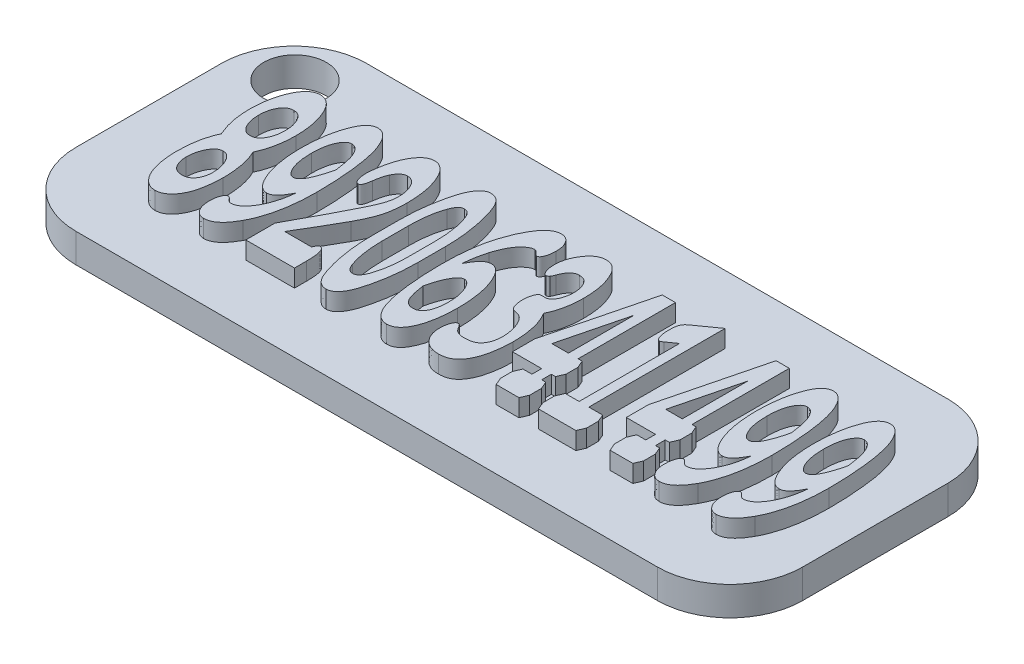
from build123d import *

# Parameters (mm, degrees)
SKETCH_1_W          = 50
SKETCH_1_H          = 20
EXTRUDE_1_DEPTH     = 2
EXTRUDE_446_DEPTH   = 1.2
FILLET_1_R          = 5
FILLET_2_R          = 5
FILLET_3_R          = 5
FILLET_4_R          = 5
SKETCH_4_R          = 2.151855383
CUT_EXTRUDE_1_DEPTH = 3


with BuildPart() as part:
    # Эскиз1 → Бобышка-Вытянуть1 (new body)
    with BuildSketch(Plane(origin=(0, 0, 0), x_dir=(1, 0, 0), z_dir=(0, 1, 0))):
        with Locations((25, 10)):
            Rectangle(SKETCH_1_W, SKETCH_1_H)
    extrude(amount=EXTRUDE_1_DEPTH)

    # Эскиз2 → Extrude 446 (add)
    # profile 1 of 11: a face of its own
    with BuildSketch(Plane(origin=(0, 2, 0), x_dir=(1, 0, 0), z_dir=(0, 1, 0))):
        with BuildLine():
            add(Edge.make_bspline(
                [(7.573556309, 9.600285908), (7.614097975, 9.514557394), (7.696746897, 9.339789807), (7.797801731, 9.062374027), (7.880558655, 8.767248004), (7.951489199, 8.456701902), (8.00595283, 8.129212501), (8.044897616, 7.785319285), (8.06867813, 7.42575086), (8.071567234, 7.180504155), (8.073036116, 7.05581548)],
                knots=[0, 0, 0, 0, 0.869863627, 1.773318598, 2.705048754, 3.681115649, 4.69499462, 5.749702211, 6.855900433, 8, 8, 8, 8], degree=3))
            add(Edge.make_bspline(
                [(8.073036116, 7.05581548), (8.071300059, 6.917145605), (8.067898843, 6.645468945), (8.03317454, 6.246264419), (7.975620786, 5.864714253), (7.898566629, 5.502509161), (7.800399961, 5.166235556), (7.670137386, 4.865473177), (7.520838011, 4.597477557), (7.339918246, 4.372882613), (7.143065075, 4.191376949), (6.932401715, 4.057830032), (6.707417427, 3.977887628), (6.552534727, 3.967409177), (6.47522375, 3.962178772)],
                knots=[0, 0, 0, 0, 1.307194334, 2.561004629, 3.774488178, 4.943198719, 6.050810285, 7.0706307, 8.027859035, 8.934048178, 9.777701725, 10.541735887, 11.272095442, 12, 12, 12, 12], degree=3))
            add(Edge.make_bspline(
                [(6.47522375, 3.962178772), (6.398758529, 3.967377244), (6.245524582, 3.977794821), (6.022692765, 4.058574413), (5.812990911, 4.190715372), (5.618085633, 4.372268194), (5.44331203, 4.599271211), (5.292379621, 4.86580684), (5.163838969, 5.168326766), (5.064629644, 5.505868942), (4.987398844, 5.868910316), (4.934027364, 6.250889169), (4.897970237, 6.648043089), (4.894747173, 6.91800445), (4.89310185, 7.05581548)],
                knots=[0, 0, 0, 0, 0.721796221, 1.446457375, 2.212675403, 3.05265627, 3.951211607, 4.911176021, 5.941488938, 7.052266429, 8.232375546, 9.44812684, 10.697308883, 12, 12, 12, 12], degree=3))
            add(Edge.make_bspline(
                [(4.89310185, 7.05581548), (4.894568323, 7.180504891), (4.897452689, 7.425753043), (4.9212673, 7.78531105), (4.960090766, 8.129241336), (5.014981174, 8.456600333), (5.08446419, 8.767842206), (5.172490412, 9.061301884), (5.268561762, 9.340392082), (5.351724858, 9.514667147), (5.392581656, 9.600285908)],
                knots=[0, 0, 0, 0, 1.144171302, 2.250438881, 3.305212602, 4.319155143, 5.295283236, 6.229301096, 7.130081833, 8, 8, 8, 8], degree=3))
            add(Edge.make_bspline(
                [(5.392581656, 9.600285908), (5.315817568, 9.787048365), (5.160841455, 10.164096025), (5.006931525, 10.766990108), (4.909981225, 11.402377485), (4.898807421, 11.838421115), (4.89310185, 12.061073855)],
                knots=[0, 0, 0, 0, 0.957073933, 1.932200357, 2.944139471, 4, 4, 4, 4], degree=3))
            add(Edge.make_bspline(
                [(4.89310185, 12.061073855), (4.898418341, 12.27754542), (4.908708054, 12.696511582), (4.993522254, 13.301262805), (5.130459125, 13.859724169), (5.292766455, 14.287625184), (5.444959878, 14.59626455), (5.572022432, 14.792435075), (5.701256202, 14.962512673), (5.841669645, 15.100122201), (5.988929324, 15.210766986), (6.147233304, 15.286698295), (6.313045616, 15.333643061), (6.426107165, 15.339862642), (6.483068983, 15.342996144)],
                knots=[0, 0, 0, 0, 1.967284804, 3.807547495, 5.539313067, 7.184775065, 7.957393082, 8.663057112, 9.306676465, 9.895090154, 10.445108397, 10.973224193, 11.482697546, 12, 12, 12, 12], degree=3))
            add(Edge.make_bspline(
                [(6.483068983, 15.342996144), (6.540030622, 15.339862528), (6.653091816, 15.33364272), (6.818906789, 15.286699655), (6.977200186, 15.210761579), (7.124502289, 15.100143922), (7.264739854, 14.962421929), (7.394438864, 14.793194832), (7.518098227, 14.595404626), (7.670991349, 14.28749902), (7.836385865, 13.860286235), (7.972388537, 13.301187823), (8.057492836, 12.696532351), (8.06774106, 12.277552495), (8.073036116, 12.061073855)],
                knots=[0, 0, 0, 0, 0.517362775, 1.026895537, 1.555072916, 2.105155296, 2.693637599, 3.337332004, 4.038837688, 4.811545799, 6.460041003, 8.192008513, 10.032485794, 12, 12, 12, 12], degree=3))
            add(Edge.make_bspline(
                [(8.073036116, 12.061073855), (8.067469393, 11.836644637), (8.056587536, 11.397929314), (7.95824123, 10.760579226), (7.810565083, 10.157347516), (7.651813566, 9.784220506), (7.573556309, 9.600285908)],
                knots=[0, 0, 0, 0, 1.063791813, 2.079505389, 3.053283751, 4, 4, 4, 4], degree=3))
        make_face()
        with BuildLine():
            add(Edge.make_bspline(
                [(7.40357627, 12.000927072), (7.400881187, 12.101399241), (7.3956698, 12.295678693), (7.346723591, 12.574577781), (7.273005759, 12.832078474), (7.163415472, 13.060108044), (7.032907644, 13.254347429), (6.872502773, 13.398604446), (6.686741605, 13.488581823), (6.552877353, 13.497503384), (6.48568406, 13.50198157)],
                knots=[0, 0, 0, 0, 1.239528042, 2.396831194, 3.486589409, 4.536162785, 5.509682768, 6.35620442, 7.174895202, 8, 8, 8, 8], degree=3))
            add(Edge.make_bspline(
                [(6.48568406, 13.50198157), (6.41756145, 13.497655353), (6.282708964, 13.489091368), (6.096066845, 13.397823779), (5.933161756, 13.255405207), (5.802856554, 13.059951899), (5.693093666, 12.832123363), (5.619425513, 12.574564807), (5.570465074, 12.295682293), (5.565255725, 12.101400468), (5.562561695, 12.000927072)],
                knots=[0, 0, 0, 0, 0.833820688, 1.650594315, 2.50321944, 3.474459699, 4.521575254, 5.608781546, 6.763374602, 8, 8, 8, 8], degree=3))
            add(Edge.make_bspline(
                [(5.562561695, 12.000927072), (5.565266502, 11.89959127), (5.570497938, 11.703595072), (5.619342719, 11.422020541), (5.693413454, 11.162223891), (5.80108844, 10.931934152), (5.93514389, 10.738900345), (6.094340772, 10.592500066), (6.283734232, 10.506365477), (6.417745012, 10.495115588), (6.48568406, 10.489412265)],
                knots=[0, 0, 0, 0, 1.241668429, 2.401543046, 3.494043673, 4.546047416, 5.504137523, 6.359918461, 7.168532727, 8, 8, 8, 8], degree=3))
            add(Edge.make_bspline(
                [(6.48568406, 10.489412265), (6.552695802, 10.495261034), (6.685717473, 10.506871134), (6.874233464, 10.591733044), (7.030924822, 10.739942893), (7.165187614, 10.931776637), (7.272684512, 11.162269517), (7.346806805, 11.422007357), (7.395636821, 11.703598728), (7.400870371, 11.899592516), (7.40357627, 12.000927072)],
                knots=[0, 0, 0, 0, 0.822795555, 1.633290479, 2.483061068, 3.443379481, 4.497829953, 5.592871494, 6.755443724, 8, 8, 8, 8], degree=3))
        make_face(mode=Mode.SUBTRACT)
        with BuildLine():
            add(Edge.make_bspline(
                [(7.40357627, 7.032279782), (7.40083224, 7.132728778), (7.395428238, 7.330549733), (7.344625757, 7.619766765), (7.260193419, 7.893490889), (7.148083999, 8.145792408), (7.013914707, 8.362633192), (6.856156217, 8.525506054), (6.676981716, 8.630098946), (6.547067499, 8.642358414), (6.483068983, 8.64839769)],
                knots=[0, 0, 0, 0, 1.189489759, 2.34254209, 3.466495789, 4.576118851, 5.607605723, 6.469471387, 7.246028937, 8, 8, 8, 8], degree=3))
            add(Edge.make_bspline(
                [(6.483068983, 8.64839769), (6.419071355, 8.642357997), (6.289158942, 8.630097682), (6.109970089, 8.525511526), (5.952276444, 8.362608226), (5.817382195, 8.145228937), (5.706032156, 7.890764764), (5.62148475, 7.614512598), (5.570417776, 7.320959943), (5.565221953, 7.119656519), (5.562561695, 7.016589317)],
                knots=[0, 0, 0, 0, 0.748318014, 1.519053169, 2.374456823, 3.398209916, 4.508873786, 5.634203001, 6.788713712, 8, 8, 8, 8], degree=3))
            add(Edge.make_bspline(
                [(5.562561695, 7.016589317), (5.564519013, 6.937906225), (5.568358614, 6.783556341), (5.614649943, 6.561063276), (5.686188734, 6.353459053), (5.781401031, 6.163023537), (5.912177847, 6.003496362), (6.075347034, 5.885390745), (6.270349502, 5.815595323), (6.410142975, 5.807445081), (6.483068983, 5.803193347)],
                knots=[0, 0, 0, 0, 1.103259055, 2.164224919, 3.174489227, 4.181783474, 5.137723691, 6.0412155, 6.978161634, 8, 8, 8, 8], degree=3))
            add(Edge.make_bspline(
                [(6.483068983, 5.803193347), (6.556895147, 5.807344341), (6.697617482, 5.81525668), (6.893245968, 5.885521907), (7.056713141, 6.002687874), (7.184294754, 6.164041181), (7.28132663, 6.35464223), (7.350843043, 6.565721818), (7.39824932, 6.79308981), (7.401765162, 6.950957658), (7.40357627, 7.032279782)],
                knots=[0, 0, 0, 0, 1.024249911, 1.952354446, 2.84732035, 3.786524278, 4.784313077, 5.807988776, 6.870833993, 8, 8, 8, 8], degree=3))
        make_face(mode=Mode.SUBTRACT)
    # profile 2 of 11: a face of its own
    with BuildSketch(Plane(origin=(0, 2, 0), x_dir=(1, 0, 0), z_dir=(0, 1, 0))):
        with BuildLine():
            add(Edge.make_bspline(
                [(11.487281327, 8.64839769), (11.443120138, 8.563194295), (11.360211839, 8.403233281), (11.227347166, 8.189670085), (11.101271099, 8.014308364), (10.981695952, 7.875258561), (10.860868515, 7.771543805), (10.73789485, 7.699387944), (10.611308828, 7.650740653), (10.523600736, 7.646361206), (10.480476482, 7.644207922)],
                knots=[0, 0, 0, 0, 1.544491333, 2.899630935, 4.044871523, 5.019150062, 5.845686048, 6.594201469, 7.308797954, 8, 8, 8, 8], degree=3))
            add(Edge.make_bspline(
                [(10.480476482, 7.644207922), (10.430290606, 7.647817631), (10.329782088, 7.655046887), (10.183984439, 7.712466058), (10.043153577, 7.800943198), (9.907418997, 7.92533019), (9.779803639, 8.086066605), (9.65342786, 8.277990517), (9.534963838, 8.506651707), (9.42092589, 8.765889021), (9.31824374, 9.051066319), (9.226522564, 9.355676466), (9.147531027, 9.677551496), (9.086438701, 10.01754375), (9.035758997, 10.373307064), (9.003124173, 10.746078019), (8.981616037, 11.135084147), (8.978430245, 11.400300708), (8.976806907, 11.535443274)],
                knots=[0, 0, 0, 0, 0.540116355, 1.081704643, 1.668900416, 2.328128021, 3.056702268, 3.878395356, 4.803970782, 5.831493441, 6.932328587, 8.071895476, 9.262630745, 10.505951035, 11.797462611, 13.138567462, 14.541941224, 16, 16, 16, 16], degree=3))
            add(Edge.make_bspline(
                [(8.976806907, 11.535443274), (8.979878585, 11.746549179), (8.985894355, 12.159992454), (9.045914146, 12.764320197), (9.136496445, 13.340136315), (9.231105871, 13.708310595), (9.277540822, 13.889013043)],
                knots=[0, 0, 0, 0, 1.064168464, 2.084135415, 3.059680597, 4, 4, 4, 4], degree=3))
            add(Edge.make_bspline(
                [(9.277540822, 13.889013043), (9.312722205, 14.002800007), (9.379225867, 14.217892454), (9.495353429, 14.516034372), (9.625556706, 14.767410328), (9.763771865, 14.976387376), (9.915484797, 15.139702578), (10.080541985, 15.254844306), (10.256576245, 15.329464525), (10.3795264, 15.338473449), (10.441250319, 15.342996144)],
                knots=[0, 0, 0, 0, 1.436180298, 2.714823602, 3.852703128, 4.844061658, 5.728925662, 6.522115595, 7.258066685, 8, 8, 8, 8], degree=3))
            add(Edge.make_bspline(
                [(10.441250319, 15.342996144), (10.48499613, 15.339980522), (10.572875844, 15.333922523), (10.703346169, 15.300039727), (10.826729708, 15.236568608), (10.949335325, 15.155760012), (11.063874085, 15.046298247), (11.173728678, 14.913745616), (11.28098276, 14.759182636), (11.382705398, 14.580405977), (11.477619014, 14.379480761), (11.571081288, 14.158754904), (11.651873381, 13.915640274), (11.733225342, 13.653416946), (11.797527188, 13.367406965), (11.864523737, 13.062959851), (11.921962435, 12.736666198), (11.986351341, 12.271998383), (12.057994352, 11.670208848), (12.112579501, 10.931994349), (12.152408758, 10.178655307), (12.155287663, 9.670948051), (12.156741173, 9.414615404)],
                knots=[0, 0, 0, 0, 0.402210474, 0.807989175, 1.226820742, 1.670824282, 2.152214144, 2.674888608, 3.249973138, 3.877429647, 4.56122259, 5.289612762, 6.07684574, 6.9125179, 7.809462526, 8.76710454, 9.775136441, 10.85051479, 13.074497134, 15.338564747, 17.646521651, 20, 20, 20, 20], degree=3))
            add(Edge.make_bspline(
                [(12.156741173, 9.414615404), (12.154611607, 9.200102556), (12.15046068, 8.781976483), (12.107252636, 8.171989025), (12.0400466, 7.594116992), (11.946568186, 7.048348086), (11.828035131, 6.533913539), (11.677341373, 6.054064828), (11.505265073, 5.603486626), (11.361652133, 5.323489564), (11.291150513, 5.186035052)],
                knots=[0, 0, 0, 0, 1.180832844, 2.301666342, 3.364825312, 4.382616933, 5.348807173, 6.268666431, 7.150063902, 8, 8, 8, 8], degree=3))
            add(Edge.make_bspline(
                [(11.291150513, 5.186035052), (11.235884251, 5.089309312), (11.130582541, 4.905012684), (10.958139223, 4.654318466), (10.779370561, 4.444113433), (10.599607472, 4.268136364), (10.411664053, 4.132527393), (10.219965318, 4.034140776), (10.023105765, 3.972455853), (9.889884021, 3.965576274), (9.824092024, 3.962178772)],
                knots=[0, 0, 0, 0, 1.334909709, 2.54347351, 3.640443885, 4.638032018, 5.551364312, 6.406426828, 7.213008643, 8, 8, 8, 8], degree=3))
            add(Edge.make_bspline(
                [(9.824092024, 3.962178772), (9.753406595, 3.967465112), (9.615349029, 3.977790002), (9.423069807, 4.06783393), (9.260135852, 4.216415572), (9.18270215, 4.345824267), (9.141556791, 4.414587183)],
                knots=[0, 0, 0, 0, 0.978915843, 1.911946217, 2.890486694, 4, 4, 4, 4], degree=3))
            add(Edge.make_bspline(
                [(9.141556791, 4.414587183), (9.115145115, 4.467877985), (9.060198525, 4.578743643), (9.014743898, 4.768366881), (8.981635621, 4.978252173), (8.978467391, 5.12659397), (8.976806907, 5.204340595)],
                knots=[0, 0, 0, 0, 0.873536651, 1.817297042, 2.856035239, 4, 4, 4, 4], degree=3))
            add(Edge.make_bspline(
                [(8.976806907, 5.204340595), (8.978729981, 5.267999654), (8.982426179, 5.390353994), (8.998760292, 5.565793479), (9.033354377, 5.724389396), (9.079353503, 5.863724378), (9.133354691, 5.981932664), (9.199664895, 6.06619865), (9.269097869, 6.12918679), (9.324484335, 6.135111997), (9.350762992, 6.13792327)],
                knots=[0, 0, 0, 0, 1.419175441, 2.727691474, 3.920195547, 5.025849715, 5.998814525, 6.787596777, 7.424763283, 8, 8, 8, 8], degree=3))
            add(Edge.make_bspline(
                [(9.350762992, 6.13792327), (9.382773052, 6.127965343), (9.463422998, 6.102876158), (9.515491409, 6.035018737), (9.546893807, 5.994094006)],
                knots=[0, 0, 0, 0, 0.793802374, 2, 2, 2, 2], degree=3))
            add(Edge.make_bspline(
                [(9.546893807, 5.994094006), (9.570445248, 5.965433361), (9.614066841, 5.912348585), (9.687655126, 5.848914152), (9.76703836, 5.812349348), (9.821161039, 5.806200307), (9.847627721, 5.803193347)],
                knots=[0, 0, 0, 0, 1.206683572, 2.234999471, 3.136892176, 4, 4, 4, 4], degree=3))
            add(Edge.make_bspline(
                [(9.847627721, 5.803193347), (9.895024222, 5.805572391), (9.989720428, 5.810325621), (10.128519102, 5.853825328), (10.266772506, 5.915780341), (10.398905962, 6.009581437), (10.529753296, 6.126311855), (10.652963112, 6.272450751), (10.780009499, 6.439005536), (10.940586919, 6.702591136), (11.122986817, 7.069602289), (11.295376695, 7.554890094), (11.421772, 8.085457175), (11.464993829, 8.456874799), (11.487281327, 8.64839769)],
                knots=[0, 0, 0, 0, 0.484168293, 0.967347815, 1.478659544, 2.030891222, 2.618845486, 3.27058146, 3.984812665, 4.762718328, 6.427668094, 8.172882214, 10.026532363, 12, 12, 12, 12], degree=3))
        make_face()
        with BuildLine():
            add(Edge.make_bspline(
                [(11.487281327, 11.404689398), (11.47548573, 11.496273531), (11.452760452, 11.672718592), (11.41340804, 11.926438075), (11.372022499, 12.160375645), (11.326387468, 12.37366511), (11.272439781, 12.565796569), (11.220164612, 12.73811608), (11.158413363, 12.888401877), (11.079735552, 13.055990953), (10.970393897, 13.225893267), (10.8255493, 13.381089174), (10.666311975, 13.485428052), (10.549776703, 13.496594222), (10.493551869, 13.50198157)],
                knots=[0, 0, 0, 0, 1.341561386, 2.584638553, 3.72986605, 4.793097259, 5.751690096, 6.62885173, 7.407292807, 8.109698356, 9.318098846, 10.321251498, 11.190053334, 12, 12, 12, 12], degree=3))
            add(Edge.make_bspline(
                [(10.493551869, 13.50198157), (10.435451232, 13.494972666), (10.31510073, 13.480454321), (10.150726883, 13.367165454), (10.007173173, 13.192292277), (9.880718397, 12.957059594), (9.774400208, 12.669553324), (9.701609912, 12.334202888), (9.653881713, 11.956967505), (9.648886848, 11.690769847), (9.646266752, 11.551133739)],
                knots=[0, 0, 0, 0, 0.604297075, 1.251749713, 2.021041256, 2.959625801, 4.029815661, 5.217391592, 6.540360535, 8, 8, 8, 8], degree=3))
            add(Edge.make_bspline(
                [(9.646266752, 11.551133739), (9.648909721, 11.404532897), (9.653959121, 11.124451504), (9.701587485, 10.727252939), (9.774512787, 10.371772355), (9.882102547, 10.06705024), (10.009809031, 9.81850141), (10.146841716, 9.634937696), (10.297793082, 9.510461458), (10.411680806, 9.493248707), (10.464786016, 9.485222497)],
                knots=[0, 0, 0, 0, 1.482531622, 2.83238157, 4.041481393, 5.146072842, 6.092829469, 6.853155664, 7.465232874, 8, 8, 8, 8], degree=3))
            add(Edge.make_bspline(
                [(10.464786016, 9.485222497), (10.5123559, 9.491123235), (10.615011535, 9.503857005), (10.753207026, 9.6101873), (10.88780989, 9.763359278), (11.015431521, 9.978643306), (11.139812025, 10.250918549), (11.2610164, 10.581959775), (11.381437375, 10.971900123), (11.45050874, 11.254328597), (11.487281327, 11.404689398)],
                knots=[0, 0, 0, 0, 0.497696831, 1.074027963, 1.777276761, 2.652500584, 3.697328195, 4.93381738, 6.367609082, 8, 8, 8, 8], degree=3))
        make_face(mode=Mode.SUBTRACT)
    # profile 3 of 11: a face of its own
    with BuildSketch(Plane(origin=(0, 2, 0), x_dir=(1, 0, 0), z_dir=(0, 1, 0))):
        with BuildLine():
            Line((13.395241887, 5.970558308), (15.236256462, 5.970558308))
            add(Edge.make_bspline(
                [(15.236256462, 5.970558308), (15.256515809, 6.020365842), (15.292357716, 6.108483042), (15.357985167, 6.211420135), (15.416245749, 6.287769686), (15.466187484, 6.300082229), (15.487303904, 6.305288231)],
                knots=[0, 0, 0, 0, 1.476957829, 2.612965951, 3.413532736, 4, 4, 4, 4], degree=3))
            add(Edge.make_bspline(
                [(15.487303904, 6.305288231), (15.518828242, 6.301902429), (15.583925969, 6.29491075), (15.668282977, 6.227348066), (15.742609241, 6.130570934), (15.800823411, 5.990750979), (15.851281352, 5.80865021), (15.880979504, 5.574693963), (15.901814361, 5.288420588), (15.904342621, 5.079747466), (15.905716307, 4.96636854)],
                knots=[0, 0, 0, 0, 0.49648233, 1.025235526, 1.659617377, 2.437817421, 3.419908268, 4.671012068, 6.191252082, 8, 8, 8, 8], degree=3))
            Line((15.905716307, 4.96636854), (15.905716307, 4.129543734))
            Line((15.905716307, 4.129543734), (12.55841708, 4.129543734))
            Line((12.55841708, 4.129543734), (12.55841708, 6.13792327))
            add(Edge.make_bspline(
                [(12.55841708, 6.13792327), (12.641397942, 6.289505408), (12.80341799, 6.585469376), (13.037886444, 7.020527309), (13.264145856, 7.432033631), (13.472134694, 7.825888853), (13.671585993, 8.1963858), (13.857265847, 8.546809745), (14.029897402, 8.877616955), (14.192103673, 9.186138894), (14.337684754, 9.476000761), (14.475904435, 9.741625587), (14.594729515, 9.990791725), (14.703631995, 10.217870427), (14.805535581, 10.421570363), (14.88824077, 10.607296972), (14.958900225, 10.772409732), (15.00184386, 10.875541131), (15.021820105, 10.923515134)],
                knots=[0, 0, 0, 0, 1.540533833, 3.007890707, 4.405782956, 5.726830237, 6.978398166, 8.156831539, 9.262153626, 10.304869543, 11.264060161, 12.153748005, 12.973970219, 13.724693827, 14.398925648, 15.004106032, 15.536736427, 16, 16, 16, 16], degree=3))
            add(Edge.make_bspline(
                [(15.021820105, 10.923515134), (15.054725346, 11.012803483), (15.118791104, 11.186645874), (15.187113675, 11.449056476), (15.228311427, 11.704973621), (15.233635861, 11.873516607), (15.236256462, 11.956470755)],
                knots=[0, 0, 0, 0, 1.07571973, 2.094401928, 3.062095275, 4, 4, 4, 4], degree=3))
            add(Edge.make_bspline(
                [(15.236256462, 11.956470755), (15.233344945, 12.055160121), (15.227641701, 12.248478463), (15.180130156, 12.52883871), (15.100911714, 12.791628836), (14.993919429, 13.02943843), (14.86577862, 13.236699105), (14.705604701, 13.387708744), (14.522676472, 13.486950637), (14.390150942, 13.496956472), (14.323594407, 13.50198157)],
                knots=[0, 0, 0, 0, 1.201656711, 2.353873494, 3.452380439, 4.536004299, 5.525640415, 6.397189124, 7.195041602, 8, 8, 8, 8], degree=3))
            add(Edge.make_bspline(
                [(14.323594407, 13.50198157), (14.254831396, 13.494914998), (14.115548402, 13.480601296), (13.926348402, 13.3573784), (13.755376411, 13.174753228), (13.672836974, 13.015707477), (13.627983786, 12.929279592)],
                knots=[0, 0, 0, 0, 0.862288605, 1.746609652, 2.775473348, 4, 4, 4, 4], degree=3))
            add(Edge.make_bspline(
                [(13.627983786, 12.929279592), (13.602992354, 12.873141503), (13.548444733, 12.750611543), (13.493761476, 12.53994957), (13.436507375, 12.295491383), (13.409616198, 12.11887216), (13.395241887, 12.02446277)],
                knots=[0, 0, 0, 0, 0.785419257, 1.714297573, 2.77820903, 4, 4, 4, 4], degree=3))
            add(Edge.make_bspline(
                [(13.395241887, 12.02446277), (13.387069001, 11.965968447), (13.372010777, 11.858194933), (13.34336405, 11.70960157), (13.311610243, 11.587103538), (13.271679086, 11.490968288), (13.230276401, 11.417229793), (13.182753184, 11.364769515), (13.127376187, 11.332889361), (13.087894837, 11.328439245), (13.068357197, 11.326237072)],
                knots=[0, 0, 0, 0, 1.718687884, 3.166615548, 4.403826944, 5.393296858, 6.189559062, 6.853582291, 7.432686669, 8, 8, 8, 8], degree=3))
            add(Edge.make_bspline(
                [(13.068357197, 11.326237072), (13.044713676, 11.329293628), (12.99338818, 11.33592882), (12.930412657, 11.398712594), (12.869384978, 11.482858918), (12.801202791, 11.648894906), (12.739845015, 11.898293317), (12.730632698, 12.111137563), (12.725782041, 12.223208662)],
                knots=[0, 0, 0, 0, 0.410077716, 0.890199137, 1.495835442, 2.252637047, 4.026861929, 6, 6, 6, 6], degree=3))
            add(Edge.make_bspline(
                [(12.725782041, 12.223208662), (12.728815601, 12.318313789), (12.735290836, 12.521318865), (12.77422712, 12.840865069), (12.835261829, 13.194319076), (12.918971663, 13.569169767), (13.022294715, 13.943533333), (13.155847877, 14.288980572), (13.312290667, 14.593551393), (13.488026402, 14.856726328), (13.681893014, 15.068162975), (13.885222111, 15.227451668), (14.104068998, 15.32292409), (14.254776852, 15.336383229), (14.328824562, 15.342996144)],
                knots=[0, 0, 0, 0, 0.906154377, 1.934216822, 3.063307913, 4.32257274, 5.592200714, 6.759641067, 7.844211716, 8.848486001, 9.765233724, 10.565799872, 11.295330456, 12, 12, 12, 12], degree=3))
            add(Edge.make_bspline(
                [(14.328824562, 15.342996144), (14.385771424, 15.339953901), (14.499040263, 15.333902796), (14.664553054, 15.285665935), (14.817813019, 15.200380847), (14.967071375, 15.089971532), (15.104667497, 14.943082526), (15.236981767, 14.766816905), (15.354254053, 14.555247478), (15.511374069, 14.23283751), (15.670655024, 13.778714607), (15.809539407, 13.186274379), (15.889240053, 12.53916926), (15.900088879, 12.090057806), (15.905716307, 11.857097809)],
                knots=[0, 0, 0, 0, 0.494761144, 0.984093207, 1.482556146, 2.013120243, 2.59204621, 3.225693145, 3.925144707, 4.691273024, 6.343201327, 8.095260062, 9.974560224, 12, 12, 12, 12], degree=3))
            add(Edge.make_bspline(
                [(15.905716307, 11.857097809), (15.904753709, 11.736733462), (15.902860443, 11.499997211), (15.87176809, 11.151877055), (15.828355736, 10.816505679), (15.765399682, 10.483248666), (15.663545782, 10.133051495), (15.514455541, 9.745534622), (15.314670037, 9.309693271), (15.155872151, 9.007625217), (15.071506578, 8.847143582)],
                knots=[0, 0, 0, 0, 0.912749152, 1.795222735, 2.649062997, 3.477746559, 4.365161243, 5.411535187, 6.624809669, 8, 8, 8, 8], degree=3))
            add(Edge.make_bspline(
                [(15.071506578, 8.847143582), (15.031581512, 8.773825367), (14.94387655, 8.612764363), (14.79702994, 8.352837412), (14.628845761, 8.050926867), (14.426443944, 7.714093246), (14.206982633, 7.333265212), (13.960677941, 6.913219275), (13.684569595, 6.456656537), (13.494411642, 6.137172984), (13.395241887, 5.970558308)],
                knots=[0, 0, 0, 0, 0.601747611, 1.321882616, 2.151886391, 3.092629613, 4.154122148, 5.320095706, 6.602396334, 8, 8, 8, 8], degree=3))
        make_face()
    # profile 4 of 11: a face of its own
    with BuildSketch(Plane(origin=(0, 2, 0), x_dir=(1, 0, 0), z_dir=(0, 1, 0))):
        with BuildLine():
            Line((19.822056403, 10.596630443), (19.822056403, 8.708544473))
            add(Edge.make_bspline(
                [(19.822056403, 8.708544473), (19.816904474, 8.432046079), (19.806694901, 7.884109393), (19.728905569, 7.070741409), (19.601642054, 6.274674293), (19.451951183, 5.63174011), (19.313920316, 5.148200517), (19.193082113, 4.835397678), (19.06453519, 4.569216662), (18.923019986, 4.351387393), (18.770942105, 4.178403035), (18.603583293, 4.055362338), (18.423626723, 3.975058565), (18.297372791, 3.966451197), (18.234704347, 3.962178772)],
                knots=[0, 0, 0, 0, 1.872673122, 3.711075104, 5.529225634, 7.329580626, 8.179610133, 8.932920447, 9.598355524, 10.178084822, 10.688068346, 11.148661017, 11.577422355, 12, 12, 12, 12], degree=3))
            add(Edge.make_bspline(
                [(18.234704347, 3.962178772), (18.163098049, 3.967442375), (18.020515124, 3.977923294), (17.820093188, 4.072884992), (17.637367438, 4.219142558), (17.507076275, 4.38689956), (17.407594793, 4.550345663), (17.336287846, 4.703103417), (17.263184898, 4.8785026), (17.189774986, 5.077118893), (17.120233422, 5.300186804), (17.049784906, 5.546112318), (16.978525016, 5.816051721), (16.888149788, 6.211811939), (16.790591085, 6.731524411), (16.702797356, 7.374529202), (16.653931287, 8.035706193), (16.646085967, 8.482701241), (16.642122137, 8.708544473)],
                knots=[0, 0, 0, 0, 0.642640119, 1.279629165, 1.962282587, 2.739474992, 3.180359586, 3.686689951, 4.257568184, 4.894314614, 5.595458888, 6.364336271, 7.20144684, 8.113027288, 10.024980623, 11.968482452, 13.963084925, 16, 16, 16, 16], degree=3))
            Line((16.642122137, 8.708544473), (16.642122137, 10.596630443))
            add(Edge.make_bspline(
                [(16.642122137, 10.596630443), (16.647338081, 10.872247431), (16.657690701, 11.419292825), (16.734721099, 12.231062213), (16.863933224, 13.025621842), (17.008956643, 13.668610802), (17.148378288, 14.152323265), (17.267667611, 14.466661007), (17.397983894, 14.733575723), (17.537583905, 14.953623625), (17.690580889, 15.125714473), (17.855665239, 15.250569948), (18.035405995, 15.33000468), (18.161603568, 15.338686677), (18.224244037, 15.342996144)],
                knots=[0, 0, 0, 0, 1.867917534, 3.707448116, 5.520882168, 7.321014604, 8.171565946, 8.930852488, 9.596696077, 10.181724631, 10.692021235, 11.148138377, 11.577162933, 12, 12, 12, 12], degree=3))
            add(Edge.make_bspline(
                [(18.224244037, 15.342996144), (18.295746132, 15.337496131), (18.437769836, 15.326571524), (18.639489124, 15.235531296), (18.820614653, 15.089256697), (18.950019221, 14.92253741), (19.048035427, 14.760581854), (19.120812757, 14.609421336), (19.192614477, 14.435164619), (19.266488855, 14.237379138), (19.339961835, 14.015236274), (19.408397177, 13.767554168), (19.480637049, 13.497027445), (19.570413226, 13.100952784), (19.671369331, 12.580785778), (19.761829259, 11.936910266), (19.810250111, 11.272945392), (19.818083533, 10.824213436), (19.822056403, 10.596630443)],
                knots=[0, 0, 0, 0, 0.642344401, 1.275880528, 1.958219819, 2.724006707, 3.164688423, 3.663720908, 4.234336445, 4.863422188, 5.566662655, 6.342741925, 7.179467287, 8.090628261, 10.003171379, 11.954627198, 13.948311832, 16, 16, 16, 16], degree=3))
        make_face()
        with BuildLine():
            add(Edge.make_bspline(
                [(19.152596557, 10.567864591), (19.149452051, 10.786899025), (19.143347024, 11.21215213), (19.071347173, 11.827950094), (18.968737394, 12.404280746), (18.853119647, 12.764651455), (18.796946015, 12.939739902)],
                knots=[0, 0, 0, 0, 1.090347458, 2.116898395, 3.085082863, 4, 4, 4, 4], degree=3))
            add(Edge.make_bspline(
                [(18.796946015, 12.939739902), (18.764271985, 13.023863674), (18.704875713, 13.176787521), (18.569094972, 13.357869641), (18.411050807, 13.483026909), (18.288892639, 13.495778918), (18.229474192, 13.50198157)],
                knots=[0, 0, 0, 0, 1.26538402, 2.300270066, 3.173241431, 4, 4, 4, 4], degree=3))
            add(Edge.make_bspline(
                [(18.229474192, 13.50198157), (18.200441655, 13.499864576), (18.142680317, 13.495652737), (18.059205196, 13.464342385), (17.978907912, 13.416288135), (17.903751318, 13.347044327), (17.83196916, 13.259296728), (17.768317154, 13.150454413), (17.704645893, 13.025296375), (17.669816229, 12.933163083), (17.65154206, 12.884823275)],
                knots=[0, 0, 0, 0, 0.773889233, 1.539682063, 2.354176973, 3.26093301, 4.253579485, 5.371542193, 6.620920351, 8, 8, 8, 8], degree=3))
            add(Edge.make_bspline(
                [(17.65154206, 12.884823275), (17.598097171, 12.72017243), (17.487055603, 12.378080081), (17.389224663, 11.821760087), (17.321222641, 11.21376433), (17.314877064, 10.788626753), (17.311581982, 10.567864591)],
                knots=[0, 0, 0, 0, 0.882012772, 1.832543419, 2.87449986, 4, 4, 4, 4], degree=3))
            Line((17.311581982, 10.567864591), (17.311581982, 8.737310326))
            add(Edge.make_bspline(
                [(17.311581982, 8.737310326), (17.31627713, 8.517469453), (17.325391106, 8.090725823), (17.390416227, 7.473127309), (17.499058516, 6.898580876), (17.614021161, 6.539706316), (17.669847603, 6.365435014)],
                knots=[0, 0, 0, 0, 1.09463067, 2.124839939, 3.089412786, 4, 4, 4, 4], degree=3))
            add(Edge.make_bspline(
                [(17.669847603, 6.365435014), (17.702803103, 6.28155244), (17.762518381, 6.12955744), (17.895106153, 5.945541569), (18.05544043, 5.82278276), (18.178038184, 5.809578277), (18.237319425, 5.803193347)],
                knots=[0, 0, 0, 0, 1.264540884, 2.291344674, 3.173792307, 4, 4, 4, 4], degree=3))
            add(Edge.make_bspline(
                [(18.237319425, 5.803193347), (18.266360037, 5.805301413), (18.324137438, 5.809495491), (18.407490521, 5.840940778), (18.487739272, 5.888102432), (18.560371322, 5.959142134), (18.632357475, 6.045715331), (18.695814625, 6.154771925), (18.759546358, 6.279863464), (18.794367029, 6.372006645), (18.81263648, 6.420351642)],
                knots=[0, 0, 0, 0, 0.775556524, 1.542999202, 2.359248885, 3.250723015, 4.245508079, 5.365879361, 6.617949219, 8, 8, 8, 8], degree=3))
            add(Edge.make_bspline(
                [(18.81263648, 6.420351642), (18.865812661, 6.585049981), (18.976609828, 6.928213197), (19.078833417, 7.483838031), (19.14190737, 8.092501584), (19.148937667, 8.516593437), (19.152596557, 8.737310326)],
                knots=[0, 0, 0, 0, 0.881942544, 1.837603474, 2.874589474, 4, 4, 4, 4], degree=3))
            Line((19.152596557, 8.737310326), (19.152596557, 10.567864591))
        make_face(mode=Mode.SUBTRACT)
    # profile 5 of 11: a face of its own
    with BuildSketch(Plane(origin=(0, 2, 0), x_dir=(1, 0, 0), z_dir=(0, 1, 0))):
        with BuildLine():
            add(Edge.make_bspline(
                [(21.39528704, 10.154682342), (21.438759985, 10.236309077), (21.520899692, 10.390538243), (21.651308856, 10.599142419), (21.776567179, 10.774997377), (21.901818696, 10.915862086), (22.02973155, 11.023233338), (22.159187074, 11.102280888), (22.295292926, 11.148827271), (22.387823808, 11.155553705), (22.433472816, 11.158872111)],
                knots=[0, 0, 0, 0, 1.465394451, 2.768781149, 3.896278152, 4.884185413, 5.747428652, 6.53408452, 7.276808084, 8, 8, 8, 8], degree=3))
            add(Edge.make_bspline(
                [(22.433472816, 11.158872111), (22.48192536, 11.156194171), (22.580808278, 11.150728978), (22.723354955, 11.093174475), (22.862931502, 11.008460521), (22.992552472, 10.884689411), (23.118766646, 10.730482026), (23.242143762, 10.543329261), (23.357664626, 10.32065526), (23.468887203, 10.068054689), (23.573391104, 9.791114729), (23.660818043, 9.492531935), (23.736523816, 9.178327445), (23.80036989, 8.846957387), (23.845711967, 8.49749985), (23.879655275, 8.13114278), (23.9009422, 7.748187147), (23.904130851, 7.487330812), (23.90576146, 7.353934317)],
                knots=[0, 0, 0, 0, 0.531794611, 1.085297036, 1.672178265, 2.32522636, 3.048874063, 3.867303555, 4.79175293, 5.811618404, 6.909614719, 8.053075246, 9.239715287, 10.472597587, 11.772169638, 13.123634062, 14.529086385, 16, 16, 16, 16], degree=3))
            add(Edge.make_bspline(
                [(23.90576146, 7.353934317), (23.905283401, 7.230117559), (23.904350097, 6.988392876), (23.881862594, 6.636056542), (23.850387075, 6.302077547), (23.810903025, 5.98553922), (23.75174393, 5.687608614), (23.685150763, 5.406833225), (23.604047432, 5.144697365), (23.51087966, 4.902471097), (23.407129539, 4.683773502), (23.296338521, 4.490774213), (23.172319945, 4.329776272), (23.040163616, 4.196301653), (22.899281485, 4.090176389), (22.747089537, 4.014457851), (22.584763253, 3.972376849), (22.473796198, 3.965599723), (22.41778235, 3.962178772)],
                knots=[0, 0, 0, 0, 1.474479737, 2.878593745, 4.203060936, 5.470294891, 6.675753598, 7.819022172, 8.906029523, 9.941433398, 10.907408686, 11.787057091, 12.586587044, 13.320749877, 14.018474997, 14.677833336, 15.332597931, 16, 16, 16, 16], degree=3))
            add(Edge.make_bspline(
                [(22.41778235, 3.962178772), (22.370588063, 3.964367074), (22.277920996, 3.968663854), (22.14237133, 3.997357499), (22.014998676, 4.049682425), (21.891133959, 4.116524435), (21.776166676, 4.20721522), (21.667395, 4.316133932), (21.566495422, 4.445303169), (21.468423236, 4.592078149), (21.380392234, 4.762461045), (21.29451202, 4.951391846), (21.215194806, 5.162624247), (21.14734194, 5.395269958), (21.077740317, 5.647514635), (21.015362158, 5.921399382), (20.961468666, 6.217427078), (20.894111472, 6.645678254), (20.828624024, 7.213322189), (20.766872412, 7.924791348), (20.734479193, 8.673377179), (20.72875592, 9.184462573), (20.725827194, 9.445996334)],
                knots=[0, 0, 0, 0, 0.460879461, 0.904947414, 1.344341268, 1.801511854, 2.274799441, 2.768318837, 3.301358059, 3.87264299, 4.489476175, 5.171351898, 5.898573551, 6.690187476, 7.536727362, 8.453481935, 9.431747531, 10.474256865, 12.686015176, 15.009401326, 17.446199683, 20, 20, 20, 20], degree=3))
            add(Edge.make_bspline(
                [(20.725827194, 9.445996334), (20.726505682, 9.603796197), (20.727829415, 9.911664493), (20.747627484, 10.36329967), (20.77492528, 10.795126474), (20.817014544, 11.206709153), (20.869452513, 11.598278634), (20.931108212, 11.96937017), (21.006319151, 12.320401054), (21.123913088, 12.749712011), (21.283036827, 13.240807235), (21.492635381, 13.775584755), (21.722431211, 14.236334013), (21.927964657, 14.573153617), (22.104385439, 14.798674003), (22.232257544, 14.945182683), (22.365054724, 15.067361224), (22.498587052, 15.168223314), (22.633954284, 15.245746526), (22.771105262, 15.301008711), (22.911002209, 15.337624355), (23.005954706, 15.3412102), (23.053246188, 15.342996144)],
                knots=[0, 0, 0, 0, 1.401999204, 2.735307224, 4.016131604, 5.246160239, 6.4105718, 7.526013964, 8.587922108, 9.598746015, 11.479868845, 13.172725954, 14.696815047, 16.050662122, 16.668838488, 17.239373861, 17.776548151, 18.269156699, 18.723566944, 19.157930126, 19.580603633, 20, 20, 20, 20], degree=3))
            add(Edge.make_bspline(
                [(23.053246188, 15.342996144), (23.123962979, 15.337677985), (23.262879216, 15.32723098), (23.456021418, 15.236554604), (23.625101324, 15.093144474), (23.704378845, 14.964008682), (23.746241731, 14.895817888)],
                knots=[0, 0, 0, 0, 0.97450896, 1.914327784, 2.898650478, 4, 4, 4, 4], degree=3))
            add(Edge.make_bspline(
                [(23.746241731, 14.895817888), (23.771479578, 14.843299986), (23.823793897, 14.734438152), (23.871252561, 14.55114137), (23.899832619, 14.348452902), (23.903726902, 14.206419994), (23.90576146, 14.132215252)],
                knots=[0, 0, 0, 0, 0.886041043, 1.836631874, 2.869753664, 4, 4, 4, 4], degree=3))
            add(Edge.make_bspline(
                [(23.90576146, 14.132215252), (23.90375828, 14.066833437), (23.899904195, 13.941039918), (23.884495878, 13.759109262), (23.845984748, 13.595228818), (23.801626084, 13.449677887), (23.745593311, 13.330201333), (23.68385802, 13.239740069), (23.611435061, 13.180543018), (23.556971261, 13.171452205), (23.531805374, 13.167251647)],
                knots=[0, 0, 0, 0, 1.422837942, 2.737516424, 3.960877108, 5.075903291, 6.042474134, 6.815963123, 7.45289647, 8, 8, 8, 8], degree=3))
            add(Edge.make_bspline(
                [(23.531805374, 13.167251647), (23.514788807, 13.170525066), (23.474710004, 13.178234889), (23.416355697, 13.224476809), (23.350227367, 13.29253736), (23.303909008, 13.348141335), (23.278142855, 13.379072926)],
                knots=[0, 0, 0, 0, 0.60853952, 1.433281787, 2.572176248, 4, 4, 4, 4], degree=3))
            add(Edge.make_bspline(
                [(23.278142855, 13.379072926), (23.248716927, 13.414301132), (23.197366664, 13.475776767), (23.120192301, 13.494140887), (23.087242196, 13.50198157)],
                knots=[0, 0, 0, 0, 1.146086751, 2, 2, 2, 2], degree=3))
            add(Edge.make_bspline(
                [(23.087242196, 13.50198157), (23.026157981, 13.496917383), (22.897640574, 13.486262648), (22.711296688, 13.391280426), (22.521588156, 13.253342876), (22.330518756, 13.059463115), (22.145951727, 12.80971021), (21.973360969, 12.500750853), (21.812226329, 12.13566873), (21.724126717, 11.867576322), (21.677715412, 11.726343933)],
                knots=[0, 0, 0, 0, 0.609996292, 1.283394428, 2.060442408, 2.963680496, 4.001327631, 5.168999259, 6.508614997, 8, 8, 8, 8], degree=3))
            add(Edge.make_bspline(
                [(21.677715412, 11.726343933), (21.646962428, 11.615050526), (21.582508436, 11.381794972), (21.504107294, 11.008361413), (21.443282771, 10.595011315), (21.411737121, 10.305600921), (21.39528704, 10.154682342)],
                knots=[0, 0, 0, 0, 0.86626655, 1.815574621, 2.860889655, 4, 4, 4, 4], degree=3))
        make_face()
        with BuildLine():
            add(Edge.make_bspline(
                [(21.39528704, 7.468997728), (21.416756099, 7.321322749), (21.456240388, 7.049729973), (21.539108166, 6.682439433), (21.630135559, 6.389453466), (21.73376321, 6.163794331), (21.86191938, 5.99910843), (22.013657838, 5.885596425), (22.189338797, 5.812473582), (22.315934598, 5.806349286), (22.381171265, 5.803193347)],
                knots=[0, 0, 0, 0, 1.684994445, 3.098915748, 4.247808544, 5.146074259, 5.888742617, 6.577929222, 7.267186148, 8, 8, 8, 8], degree=3))
            add(Edge.make_bspline(
                [(22.381171265, 5.803193347), (22.446700148, 5.807578839), (22.575424748, 5.816193677), (22.752114807, 5.905023451), (22.904150082, 6.041610574), (23.025133597, 6.232503429), (23.118988242, 6.466176554), (23.189091423, 6.737734156), (23.230466084, 7.046703596), (23.234285171, 7.264886507), (23.236301615, 7.380085092)],
                knots=[0, 0, 0, 0, 0.78607407, 1.544159838, 2.334451828, 3.230788347, 4.245423593, 5.366332485, 6.6094476, 8, 8, 8, 8], degree=3))
            add(Edge.make_bspline(
                [(23.236301615, 7.380085092), (23.233528134, 7.513599683), (23.228215867, 7.769330712), (23.181552282, 8.135894838), (23.101769305, 8.467193245), (22.990894148, 8.756162318), (22.864695127, 8.996141712), (22.727084316, 9.17394892), (22.576540582, 9.295636926), (22.463010866, 9.310778865), (22.409937118, 9.317857536)],
                knots=[0, 0, 0, 0, 1.42171169, 2.723116575, 3.927927152, 5.041867869, 6.014102148, 6.800051415, 7.439038768, 8, 8, 8, 8], degree=3))
            add(Edge.make_bspline(
                [(22.409937118, 9.317857536), (22.36598479, 9.31048283), (22.268142178, 9.294065942), (22.133164087, 9.18819781), (21.994605417, 9.033789884), (21.857456927, 8.818561166), (21.722330643, 8.551779989), (21.598561938, 8.234466578), (21.485827209, 7.869153977), (21.426557933, 7.607204265), (21.39528704, 7.468997728)],
                knots=[0, 0, 0, 0, 0.479474003, 1.067360729, 1.814100547, 2.747268226, 3.835419782, 5.072625612, 6.455496393, 8, 8, 8, 8], degree=3))
        make_face(mode=Mode.SUBTRACT)
    # profile 6 of 11: a face of its own
    with BuildSketch(Plane(origin=(0, 2, 0), x_dir=(1, 0, 0), z_dir=(0, 1, 0))):
        with BuildLine():
            add(Edge.make_bspline(
                [(27.176177408, 10.000392769), (27.228533004, 9.910664474), (27.33481565, 9.72851469), (27.463204204, 9.432795887), (27.577645213, 9.119262481), (27.664112298, 8.783202568), (27.735233858, 8.427968852), (27.787927736, 8.052642413), (27.815548043, 7.655961349), (27.819881457, 7.385353993), (27.822101556, 7.246716139)],
                knots=[0, 0, 0, 0, 0.869870093, 1.765849331, 2.697020677, 3.664476357, 4.670172355, 5.732180101, 6.838148042, 8, 8, 8, 8], degree=3))
            add(Edge.make_bspline(
                [(27.822101556, 7.246716139), (27.819687208, 7.095824989), (27.814947736, 6.799618892), (27.774840302, 6.364592495), (27.709839511, 5.94691275), (27.619686951, 5.551787207), (27.50894226, 5.186478734), (27.366926054, 4.866054645), (27.206006736, 4.588711235), (27.01654105, 4.360855198), (26.800083895, 4.177874768), (26.549474562, 4.051412943), (26.267736244, 3.976847623), (26.070466751, 3.967193039), (25.968011593, 3.962178772)],
                knots=[0, 0, 0, 0, 1.291726547, 2.535717178, 3.736994706, 4.908409329, 6.003690681, 6.999447235, 7.903117844, 8.7402297, 9.524786357, 10.312531561, 11.123585492, 12, 12, 12, 12], degree=3))
            add(Edge.make_bspline(
                [(25.968011593, 3.962178772), (25.899877373, 3.963991668), (25.768066169, 3.967498863), (25.576766923, 4.000261657), (25.398749249, 4.05125873), (25.233699629, 4.126188617), (25.082210228, 4.220888972), (24.940789294, 4.333435766), (24.81740252, 4.472341834), (24.746518561, 4.575902881), (24.710159305, 4.62902354)],
                knots=[0, 0, 0, 0, 1.095350794, 2.119045408, 3.113106614, 4.067187038, 5.024560244, 5.981727982, 6.964746484, 8, 8, 8, 8], degree=3))
            add(Edge.make_bspline(
                [(24.710159305, 4.62902354), (24.674076394, 4.694318602), (24.601392603, 4.825846033), (24.528945751, 5.045170288), (24.483804341, 5.280922234), (24.477851564, 5.444711319), (24.474802329, 5.528610207)],
                knots=[0, 0, 0, 0, 0.949534308, 1.912699146, 2.930806525, 4, 4, 4, 4], degree=3))
            add(Edge.make_bspline(
                [(24.474802329, 5.528610207), (24.476741956, 5.592258156), (24.480469969, 5.714591141), (24.496664227, 5.891027503), (24.532450977, 6.0504922), (24.57343872, 6.194223334), (24.630509266, 6.311125519), (24.687801179, 6.402811511), (24.759333665, 6.458883064), (24.811479825, 6.46828798), (24.835683027, 6.472653193)],
                knots=[0, 0, 0, 0, 1.419798329, 2.72888868, 3.94091535, 5.059615324, 6.05050214, 6.832177882, 7.457965195, 8, 8, 8, 8], degree=3))
            add(Edge.make_bspline(
                [(24.835683027, 6.472653193), (24.853516311, 6.470384567), (24.892944417, 6.4653688), (24.948649148, 6.427404293), (25.00017957, 6.366897443), (25.032359325, 6.318772871), (25.050119383, 6.292212844)],
                knots=[0, 0, 0, 0, 0.732052007, 1.618514138, 2.685654147, 4, 4, 4, 4], degree=3))
            add(Edge.make_bspline(
                [(25.050119383, 6.292212844), (25.075570035, 6.249906964), (25.122872757, 6.171277022), (25.198712333, 6.068669649), (25.27163877, 5.987663071), (25.324137146, 5.947263703), (25.348238221, 5.928717068)],
                knots=[0, 0, 0, 0, 1.250437822, 2.32407068, 3.230610512, 4, 4, 4, 4], degree=3))
            add(Edge.make_bspline(
                [(25.348238221, 5.928717068), (25.386916329, 5.909033315), (25.468496333, 5.867516274), (25.608883121, 5.830998988), (25.767533188, 5.806837818), (25.879857521, 5.804453818), (25.93924574, 5.803193347)],
                knots=[0, 0, 0, 0, 0.850766919, 1.794440608, 2.833874725, 4, 4, 4, 4], degree=3))
            add(Edge.make_bspline(
                [(25.93924574, 5.803193347), (26.039154516, 5.806952278), (26.227031493, 5.814020893), (26.486578508, 5.885846355), (26.706075195, 6.001196347), (26.874465688, 6.17396358), (27.001015055, 6.387320301), (27.091657762, 6.637392986), (27.143063283, 6.926478153), (27.149320904, 7.130565468), (27.15264171, 7.238870906)],
                knots=[0, 0, 0, 0, 1.111380136, 2.089933945, 2.977268555, 3.84316133, 4.741550694, 5.725494965, 6.792961411, 8, 8, 8, 8], degree=3))
            add(Edge.make_bspline(
                [(27.15264171, 7.238870906), (27.150691849, 7.322662836), (27.146798792, 7.489960303), (27.113618924, 7.737232008), (27.065168348, 7.981093706), (26.991742402, 8.214917858), (26.904325006, 8.435708246), (26.804376743, 8.634279234), (26.688151652, 8.80673854), (26.59616021, 8.902366781), (26.55117388, 8.949131605)],
                knots=[0, 0, 0, 0, 1.082694984, 2.161689439, 3.220249694, 4.293107415, 5.324695095, 6.287260835, 7.162423724, 8, 8, 8, 8], degree=3))
            add(Edge.make_bspline(
                [(26.55117388, 8.949131605), (26.521365773, 8.972032403), (26.456220214, 9.02208205), (26.33421499, 9.077518957), (26.185370848, 9.121608213), (26.07637635, 9.140384286), (26.017698066, 9.150492574)],
                knots=[0, 0, 0, 0, 0.779284847, 1.70312544, 2.763454478, 4, 4, 4, 4], degree=3))
            add(Edge.make_bspline(
                [(26.017698066, 9.150492574), (25.988775484, 9.157061242), (25.929133445, 9.170606668), (25.855285254, 9.235611015), (25.788021167, 9.320181122), (25.738569537, 9.435389333), (25.698122268, 9.569771489), (25.666852027, 9.721158069), (25.648445694, 9.887483857), (25.647072767, 10.002957877), (25.646357058, 10.063154629)],
                knots=[0, 0, 0, 0, 0.665171661, 1.371668477, 2.177345374, 3.118249364, 4.19768422, 5.372799233, 6.630436936, 8, 8, 8, 8], degree=3))
            add(Edge.make_bspline(
                [(25.646357058, 10.063154629), (25.648284148, 10.125937905), (25.651986104, 10.246545133), (25.668324209, 10.420297084), (25.703594938, 10.577458844), (25.746139332, 10.717263474), (25.798078749, 10.834827889), (25.861423168, 10.921534678), (25.933110316, 10.982170602), (25.988932165, 10.988528615), (26.015082989, 10.991507149)],
                knots=[0, 0, 0, 0, 1.40846337, 2.705670573, 3.90558276, 5.012080196, 5.982663758, 6.764465055, 7.421189778, 8, 8, 8, 8], degree=3))
            add(Edge.make_bspline(
                [(26.015082989, 10.991507149), (26.067390614, 10.99114721), (26.158938644, 10.990517249), (26.274841742, 10.99390936), (26.349887317, 10.995420091), (26.385556649, 10.998404584), (26.396884307, 10.999352382)],
                knots=[0, 0, 0, 0, 1.643077482, 2.87568983, 3.642948177, 4, 4, 4, 4], degree=3))
            add(Edge.make_bspline(
                [(26.396884307, 10.999352382), (26.444901927, 11.018282233), (26.55318926, 11.060972042), (26.689371139, 11.20697992), (26.818136199, 11.407358506), (26.905724088, 11.671089797), (26.974408052, 11.963514445), (26.981647868, 12.169597969), (26.985276749, 12.272895135)],
                knots=[0, 0, 0, 0, 0.620172094, 1.398586218, 2.364491577, 3.50284929, 4.748329874, 6, 6, 6, 6], degree=3))
            add(Edge.make_bspline(
                [(26.985276749, 12.272895135), (26.982888338, 12.353251367), (26.978236914, 12.509744865), (26.938670402, 12.735836001), (26.87261072, 12.945105178), (26.783782482, 13.1349475), (26.668037167, 13.297770549), (26.519202565, 13.418994055), (26.339742557, 13.489014657), (26.211811738, 13.497569681), (26.145836865, 13.50198157)],
                knots=[0, 0, 0, 0, 1.159006793, 2.257161925, 3.299502429, 4.317884941, 5.271428475, 6.157446033, 7.049781245, 8, 8, 8, 8], degree=3))
            add(Edge.make_bspline(
                [(26.145836865, 13.50198157), (26.101975615, 13.499382299), (26.01530805, 13.494246274), (25.890163809, 13.455632857), (25.772330929, 13.39469764), (25.664788568, 13.305974186), (25.565130997, 13.19449631), (25.472510555, 13.059774353), (25.393043814, 12.898203776), (25.346529275, 12.781432683), (25.322087445, 12.720073391)],
                knots=[0, 0, 0, 0, 0.865886865, 1.710947752, 2.566485, 3.473407852, 4.449402959, 5.51526978, 6.694357633, 8, 8, 8, 8], degree=3))
            add(Edge.make_bspline(
                [(25.322087445, 12.720073391), (25.307834122, 12.686214116), (25.28190215, 12.624611794), (25.250864616, 12.539244846), (25.216521071, 12.477619552), (25.194928784, 12.443674198), (25.186103414, 12.429799786)],
                knots=[0, 0, 0, 0, 1.37247341, 2.497027754, 3.385693339, 4, 4, 4, 4], degree=3))
            add(Edge.make_bspline(
                [(25.186103414, 12.429799786), (25.161215695, 12.401543946), (25.114641182, 12.348666383), (25.045638476, 12.33622159), (25.013508298, 12.33042684)],
                knots=[0, 0, 0, 0, 1.068727008, 2, 2, 2, 2], degree=3))
            add(Edge.make_bspline(
                [(25.013508298, 12.33042684), (24.988353375, 12.334625024), (24.935131848, 12.343507331), (24.863093441, 12.400972508), (24.80306148, 12.490334613), (24.746286474, 12.607447465), (24.701397268, 12.749398788), (24.667738164, 12.909715096), (24.64679351, 13.085643503), (24.643749689, 13.208161169), (24.64216729, 13.271854748)],
                knots=[0, 0, 0, 0, 0.559422084, 1.183597249, 1.974502074, 2.945386281, 4.067081012, 5.275985269, 6.583859345, 8, 8, 8, 8], degree=3))
            add(Edge.make_bspline(
                [(24.64216729, 13.271854748), (24.646421116, 13.375004897), (24.654963598, 13.582149768), (24.717601158, 13.889892431), (24.818839727, 14.193976341), (24.918411583, 14.385321197), (24.96905198, 14.48263564)],
                knots=[0, 0, 0, 0, 0.976199948, 1.960392838, 2.962693653, 4, 4, 4, 4], degree=3))
            add(Edge.make_bspline(
                [(24.96905198, 14.48263564), (25.008725739, 14.550589911), (25.085165975, 14.681518786), (25.215990592, 14.856642512), (25.35372696, 15.006662452), (25.499219771, 15.12929481), (25.653114611, 15.227465208), (25.817229529, 15.290615834), (25.986431042, 15.33670696), (26.102807465, 15.340887019), (26.16152733, 15.342996144)],
                knots=[0, 0, 0, 0, 1.219866735, 2.350342005, 3.383721809, 4.372337276, 5.2954325, 6.199412295, 7.091480353, 8, 8, 8, 8], degree=3))
            add(Edge.make_bspline(
                [(26.16152733, 15.342996144), (26.216704433, 15.340711367), (26.326097025, 15.336181631), (26.485172866, 15.292819006), (26.634818902, 15.219633131), (26.776011362, 15.119788917), (26.908196569, 14.991336158), (27.031601008, 14.836029745), (27.143001467, 14.649904707), (27.286621674, 14.365130777), (27.437819377, 13.966426138), (27.564558883, 13.444763264), (27.640304216, 12.877452146), (27.649818415, 12.484084223), (27.654736594, 12.280740367)],
                knots=[0, 0, 0, 0, 0.534417548, 1.059521385, 1.585237668, 2.1436049, 2.729713615, 3.367584548, 4.0622831, 4.829985653, 6.460108654, 8.184951146, 10.027885091, 12, 12, 12, 12], degree=3))
            add(Edge.make_bspline(
                [(27.654736594, 12.280740367), (27.650209639, 12.068491087), (27.641426598, 11.656692401), (27.545079331, 11.062087905), (27.402728381, 10.506863188), (27.250663474, 10.166911537), (27.176177408, 10.000392769)],
                knots=[0, 0, 0, 0, 1.082953434, 2.101108659, 3.069864656, 4, 4, 4, 4], degree=3))
        make_face()
    # profile 7 of 11: a face of its own
    with BuildSketch(Plane(origin=(0, 2, 0), x_dir=(1, 0, 0), z_dir=(0, 1, 0))):
        Polygon((31.068981806, 15.175631183), (31.068981806, 8.481032729), (31.348795101, 8.481032729), (31.57107669, 7.965862457), (31.57107669, 7.560525441), (31.57107669, 7.155188426), (31.348795101, 6.640018154), (31.068981806, 6.640018154), (31.068981806, 5.970558308), (31.348795101, 5.970558308), (31.57107669, 5.455388037), (31.57107669, 5.050051021), (31.57107669, 4.644714005), (31.348795101, 4.129543734), (31.068981806, 4.129543734), (30.064792038, 4.129543734), (29.784978743, 4.129543734), (29.562697154, 4.644714005), (29.562697154, 5.050051021), (29.562697154, 5.455388037), (29.784978743, 5.970558308), (30.064792038, 5.970558308), (30.399521961, 5.970558308), (30.399521961, 6.640018154), (28.391142424, 6.640018154), (28.391142424, 8.175068659), (30.161549906, 15.175631183), align=None)
        Polygon((30.399521961, 8.481032729), (30.399521961, 12.989426375), (29.261963239, 8.481032729), align=None, mode=Mode.SUBTRACT)
    # profile 8 of 11: a face of its own
    with BuildSketch(Plane(origin=(0, 2, 0), x_dir=(1, 0, 0), z_dir=(0, 1, 0))):
        with BuildLine():
            Line((34.315862056, 15.342996144), (34.315862056, 5.970558308))
            Line((34.315862056, 5.970558308), (34.985321902, 5.970558308))
            Line((34.985321902, 5.970558308), (35.265135197, 5.970558308))
            Line((35.265135197, 5.970558308), (35.487416786, 5.455388037))
            Line((35.487416786, 5.455388037), (35.487416786, 5.050051021))
            Line((35.487416786, 5.050051021), (35.487416786, 4.644714005))
            Line((35.487416786, 4.644714005), (35.265135197, 4.129543734))
            Line((35.265135197, 4.129543734), (34.985321902, 4.129543734))
            Line((34.985321902, 4.129543734), (32.976942366, 4.129543734))
            Line((32.976942366, 4.129543734), (32.697129071, 4.129543734))
            Line((32.697129071, 4.129543734), (32.474847481, 4.644714005))
            Line((32.474847481, 4.644714005), (32.474847481, 5.050051021))
            Line((32.474847481, 5.050051021), (32.474847481, 5.455388037))
            Line((32.474847481, 5.455388037), (32.697129071, 5.970558308))
            Line((32.697129071, 5.970558308), (32.976942366, 5.970558308))
            Line((32.976942366, 5.970558308), (33.646402211, 5.970558308))
            Line((33.646402211, 5.970558308), (33.646402211, 12.882208197))
            Line((33.646402211, 12.882208197), (33.024013761, 12.440260096))
            add(Edge.make_bspline(
                [(33.024013761, 12.440260096), (32.982072986, 12.40965096), (32.913977004, 12.35995328), (32.832880711, 12.338620585), (32.801732172, 12.33042684)],
                knots=[0, 0, 0, 0, 1.231813479, 2, 2, 2, 2], degree=3))
            add(Edge.make_bspline(
                [(32.801732172, 12.33042684), (32.778892048, 12.33445352), (32.72989452, 12.343091711), (32.670254255, 12.40749367), (32.613046322, 12.496313715), (32.567397759, 12.622229882), (32.526590644, 12.770756455), (32.495220959, 12.938682951), (32.477004278, 13.122381825), (32.475584766, 13.250017861), (32.474847481, 13.316311066)],
                knots=[0, 0, 0, 0, 0.495128156, 1.062168302, 1.834510207, 2.819056819, 3.966528459, 5.208382639, 6.55005478, 8, 8, 8, 8], degree=3))
            add(Edge.make_bspline(
                [(32.474847481, 13.316311066), (32.475927675, 13.375617271), (32.477979696, 13.488279978), (32.491040638, 13.647193476), (32.510329588, 13.786731687), (32.542041733, 13.908158067), (32.587298826, 14.017923911), (32.65395305, 14.117153701), (32.739088578, 14.21007096), (32.806169963, 14.263846838), (32.840958334, 14.291734981)],
                knots=[0, 0, 0, 0, 1.305535163, 2.480096727, 3.50872797, 4.402489535, 5.236569861, 6.109485237, 7.019580023, 8, 8, 8, 8], degree=3))
            Line((32.840958334, 14.291734981), (34.315862056, 15.342996144))
        make_face()
    # profile 9 of 11: a face of its own
    with BuildSketch(Plane(origin=(0, 2, 0), x_dir=(1, 0, 0), z_dir=(0, 1, 0))):
        Polygon((38.901661998, 15.175631183), (38.901661998, 8.481032729), (39.181475292, 8.481032729), (39.403756882, 7.965862457), (39.403756882, 7.560525441), (39.403756882, 7.155188426), (39.181475292, 6.640018154), (38.901661998, 6.640018154), (38.901661998, 5.970558308), (39.181475292, 5.970558308), (39.403756882, 5.455388037), (39.403756882, 5.050051021), (39.403756882, 4.644714005), (39.181475292, 4.129543734), (38.901661998, 4.129543734), (37.897472229, 4.129543734), (37.617658935, 4.129543734), (37.395377345, 4.644714005), (37.395377345, 5.050051021), (37.395377345, 5.455388037), (37.617658935, 5.970558308), (37.897472229, 5.970558308), (38.232202152, 5.970558308), (38.232202152, 6.640018154), (36.223822616, 6.640018154), (36.223822616, 8.175068659), (37.994230098, 15.175631183), align=None)
        Polygon((38.232202152, 8.481032729), (38.232202152, 12.989426375), (37.09464343, 8.481032729), align=None, mode=Mode.SUBTRACT)
    # profile 10 of 11: a face of its own
    with BuildSketch(Plane(origin=(0, 2, 0), x_dir=(1, 0, 0), z_dir=(0, 1, 0))):
        with BuildLine():
            add(Edge.make_bspline(
                [(42.818002093, 8.64839769), (42.773840905, 8.563194295), (42.690932605, 8.403233281), (42.558067932, 8.189670085), (42.431991865, 8.014308364), (42.312416718, 7.875258561), (42.191589281, 7.771543805), (42.068615616, 7.699387944), (41.942029594, 7.650740653), (41.854321502, 7.646361206), (41.811197248, 7.644207922)],
                knots=[0, 0, 0, 0, 1.544491333, 2.899630935, 4.044871523, 5.019150062, 5.845686048, 6.594201469, 7.308797954, 8, 8, 8, 8], degree=3))
            add(Edge.make_bspline(
                [(41.811197248, 7.644207922), (41.761011372, 7.647817631), (41.660502854, 7.655046887), (41.514705205, 7.712466058), (41.373874343, 7.800943198), (41.238139764, 7.92533019), (41.110524405, 8.086066605), (40.984148627, 8.277990517), (40.865684604, 8.506651707), (40.751646656, 8.765889021), (40.648964506, 9.051066319), (40.55724333, 9.355676466), (40.478251793, 9.677551496), (40.417159467, 10.01754375), (40.366479763, 10.373307064), (40.333844939, 10.746078019), (40.312336803, 11.135084147), (40.309151011, 11.400300708), (40.307527673, 11.535443274)],
                knots=[0, 0, 0, 0, 0.540116355, 1.081704643, 1.668900416, 2.328128021, 3.056702268, 3.878395356, 4.803970782, 5.831493441, 6.932328587, 8.071895476, 9.262630745, 10.505951035, 11.797462611, 13.138567462, 14.541941224, 16, 16, 16, 16], degree=3))
            add(Edge.make_bspline(
                [(40.307527673, 11.535443274), (40.310599351, 11.746549179), (40.316615121, 12.159992454), (40.376634912, 12.764320197), (40.467217212, 13.340136315), (40.561826637, 13.708310595), (40.608261588, 13.889013043)],
                knots=[0, 0, 0, 0, 1.064168464, 2.084135415, 3.059680597, 4, 4, 4, 4], degree=3))
            add(Edge.make_bspline(
                [(40.608261588, 13.889013043), (40.643442971, 14.002800007), (40.709946633, 14.217892454), (40.826074195, 14.516034372), (40.956277472, 14.767410328), (41.094492632, 14.976387376), (41.246205563, 15.139702578), (41.411262751, 15.254844306), (41.587297011, 15.329464525), (41.710247167, 15.338473449), (41.771971085, 15.342996144)],
                knots=[0, 0, 0, 0, 1.436180298, 2.714823602, 3.852703128, 4.844061658, 5.728925662, 6.522115595, 7.258066685, 8, 8, 8, 8], degree=3))
            add(Edge.make_bspline(
                [(41.771971085, 15.342996144), (41.815716896, 15.339980522), (41.90359661, 15.333922523), (42.034066935, 15.300039727), (42.157450474, 15.236568608), (42.280056091, 15.155760012), (42.394594851, 15.046298247), (42.504449444, 14.913745616), (42.611703526, 14.759182636), (42.713426164, 14.580405977), (42.80833978, 14.379480761), (42.901802054, 14.158754904), (42.982594147, 13.915640274), (43.063946108, 13.653416946), (43.128247954, 13.367406965), (43.195244503, 13.062959851), (43.252683201, 12.736666198), (43.317072107, 12.271998383), (43.388715119, 11.670208848), (43.443300267, 10.931994349), (43.483129524, 10.178655307), (43.486008429, 9.670948051), (43.487461939, 9.414615404)],
                knots=[0, 0, 0, 0, 0.402210474, 0.807989175, 1.226820742, 1.670824282, 2.152214144, 2.674888608, 3.249973138, 3.877429647, 4.56122259, 5.289612762, 6.07684574, 6.9125179, 7.809462526, 8.76710454, 9.775136441, 10.85051479, 13.074497134, 15.338564747, 17.646521651, 20, 20, 20, 20], degree=3))
            add(Edge.make_bspline(
                [(43.487461939, 9.414615404), (43.485332373, 9.200102556), (43.481181446, 8.781976483), (43.437973402, 8.171989025), (43.370767366, 7.594116992), (43.277288952, 7.048348086), (43.158755897, 6.533913539), (43.008062139, 6.054064828), (42.835985839, 5.603486626), (42.6923729, 5.323489564), (42.621871279, 5.186035052)],
                knots=[0, 0, 0, 0, 1.180832844, 2.301666342, 3.364825312, 4.382616933, 5.348807173, 6.268666431, 7.150063902, 8, 8, 8, 8], degree=3))
            add(Edge.make_bspline(
                [(42.621871279, 5.186035052), (42.566605017, 5.089309312), (42.461303307, 4.905012684), (42.288859989, 4.654318466), (42.110091327, 4.444113433), (41.930328238, 4.268136364), (41.742384819, 4.132527393), (41.550686084, 4.034140776), (41.353826531, 3.972455853), (41.220604787, 3.965576274), (41.15481279, 3.962178772)],
                knots=[0, 0, 0, 0, 1.334909709, 2.54347351, 3.640443885, 4.638032018, 5.551364312, 6.406426828, 7.213008643, 8, 8, 8, 8], degree=3))
            add(Edge.make_bspline(
                [(41.15481279, 3.962178772), (41.084127361, 3.967465112), (40.946069795, 3.977790002), (40.753790573, 4.06783393), (40.590856619, 4.216415572), (40.513422916, 4.345824267), (40.472277557, 4.414587183)],
                knots=[0, 0, 0, 0, 0.978915843, 1.911946217, 2.890486694, 4, 4, 4, 4], degree=3))
            add(Edge.make_bspline(
                [(40.472277557, 4.414587183), (40.445865881, 4.467877985), (40.390919291, 4.578743643), (40.345464665, 4.768366881), (40.312356387, 4.978252173), (40.309188157, 5.12659397), (40.307527673, 5.204340595)],
                knots=[0, 0, 0, 0, 0.873536651, 1.817297042, 2.856035239, 4, 4, 4, 4], degree=3))
            add(Edge.make_bspline(
                [(40.307527673, 5.204340595), (40.309450747, 5.267999654), (40.313146945, 5.390353994), (40.329481058, 5.565793479), (40.364075143, 5.724389396), (40.410074269, 5.863724378), (40.464075457, 5.981932664), (40.530385662, 6.06619865), (40.599818635, 6.12918679), (40.655205101, 6.135111997), (40.681483759, 6.13792327)],
                knots=[0, 0, 0, 0, 1.419175441, 2.727691474, 3.920195547, 5.025849715, 5.998814525, 6.787596777, 7.424763283, 8, 8, 8, 8], degree=3))
            add(Edge.make_bspline(
                [(40.681483759, 6.13792327), (40.713493818, 6.127965343), (40.794143764, 6.102876158), (40.846212176, 6.035018737), (40.877614573, 5.994094006)],
                knots=[0, 0, 0, 0, 0.793802374, 2, 2, 2, 2], degree=3))
            add(Edge.make_bspline(
                [(40.877614573, 5.994094006), (40.901166014, 5.965433361), (40.944787607, 5.912348585), (41.018375892, 5.848914152), (41.097759126, 5.812349348), (41.151881805, 5.806200307), (41.178348488, 5.803193347)],
                knots=[0, 0, 0, 0, 1.206683572, 2.234999471, 3.136892176, 4, 4, 4, 4], degree=3))
            add(Edge.make_bspline(
                [(41.178348488, 5.803193347), (41.225744988, 5.805572391), (41.320441195, 5.810325621), (41.459239868, 5.853825328), (41.597493272, 5.915780341), (41.729626728, 6.009581437), (41.860474062, 6.126311855), (41.983683878, 6.272450751), (42.110730265, 6.439005536), (42.271307685, 6.702591136), (42.453707583, 7.069602289), (42.626097461, 7.554890094), (42.752492767, 8.085457175), (42.795714595, 8.456874799), (42.818002093, 8.64839769)],
                knots=[0, 0, 0, 0, 0.484168293, 0.967347815, 1.478659544, 2.030891222, 2.618845486, 3.27058146, 3.984812665, 4.762718328, 6.427668094, 8.172882214, 10.026532363, 12, 12, 12, 12], degree=3))
        make_face()
        with BuildLine():
            add(Edge.make_bspline(
                [(42.818002093, 11.404689398), (42.806206496, 11.496273531), (42.783481218, 11.672718592), (42.744128806, 11.926438075), (42.702743265, 12.160375645), (42.657108234, 12.37366511), (42.603160547, 12.565796569), (42.550885378, 12.73811608), (42.48913413, 12.888401877), (42.410456318, 13.055990953), (42.301114664, 13.225893267), (42.156270066, 13.381089174), (41.997032741, 13.485428052), (41.880497469, 13.496594222), (41.824272635, 13.50198157)],
                knots=[0, 0, 0, 0, 1.341561386, 2.584638553, 3.72986605, 4.793097259, 5.751690096, 6.62885173, 7.407292807, 8.109698356, 9.318098846, 10.321251498, 11.190053334, 12, 12, 12, 12], degree=3))
            add(Edge.make_bspline(
                [(41.824272635, 13.50198157), (41.766171998, 13.494972666), (41.645821496, 13.480454321), (41.48144765, 13.367165454), (41.337893939, 13.192292277), (41.211439163, 12.957059594), (41.105120975, 12.669553324), (41.032330679, 12.334202888), (40.984602479, 11.956967505), (40.979607614, 11.690769847), (40.976987518, 11.551133739)],
                knots=[0, 0, 0, 0, 0.604297075, 1.251749713, 2.021041256, 2.959625801, 4.029815661, 5.217391592, 6.540360535, 8, 8, 8, 8], degree=3))
            add(Edge.make_bspline(
                [(40.976987518, 11.551133739), (40.979630487, 11.404532897), (40.984679887, 11.124451504), (41.032308251, 10.727252939), (41.105233554, 10.371772355), (41.212823313, 10.06705024), (41.340529797, 9.81850141), (41.477562482, 9.634937696), (41.628513848, 9.510461458), (41.742401572, 9.493248707), (41.795506783, 9.485222497)],
                knots=[0, 0, 0, 0, 1.482531622, 2.83238157, 4.041481393, 5.146072842, 6.092829469, 6.853155664, 7.465232874, 8, 8, 8, 8], degree=3))
            add(Edge.make_bspline(
                [(41.795506783, 9.485222497), (41.843076666, 9.491123235), (41.945732301, 9.503857005), (42.083927792, 9.6101873), (42.218530657, 9.763359278), (42.346152287, 9.978643306), (42.470532791, 10.250918549), (42.591737166, 10.581959775), (42.712158141, 10.971900123), (42.781229506, 11.254328597), (42.818002093, 11.404689398)],
                knots=[0, 0, 0, 0, 0.497696831, 1.074027963, 1.777276761, 2.652500584, 3.697328195, 4.93381738, 6.367609082, 8, 8, 8, 8], degree=3))
        make_face(mode=Mode.SUBTRACT)
    # profile 11 of 11: a face of its own
    with BuildSketch(Plane(origin=(0, 2, 0), x_dir=(1, 0, 0), z_dir=(0, 1, 0))):
        with BuildLine():
            add(Edge.make_bspline(
                [(46.734342189, 8.64839769), (46.690181, 8.563194295), (46.607272701, 8.403233281), (46.474408028, 8.189670085), (46.34833196, 8.014308364), (46.228756814, 7.875258561), (46.107929377, 7.771543805), (45.984955712, 7.699387944), (45.85836969, 7.650740653), (45.770661598, 7.646361206), (45.727537343, 7.644207922)],
                knots=[0, 0, 0, 0, 1.544491333, 2.899630935, 4.044871523, 5.019150062, 5.845686048, 6.594201469, 7.308797954, 8, 8, 8, 8], degree=3))
            add(Edge.make_bspline(
                [(45.727537343, 7.644207922), (45.677351468, 7.647817631), (45.57684295, 7.655046887), (45.431045301, 7.712466058), (45.290214439, 7.800943198), (45.154479859, 7.92533019), (45.026864501, 8.086066605), (44.900488722, 8.277990517), (44.7820247, 8.506651707), (44.667986752, 8.765889021), (44.565304602, 9.051066319), (44.473583426, 9.355676466), (44.394591889, 9.677551496), (44.333499563, 10.01754375), (44.282819858, 10.373307064), (44.250185035, 10.746078019), (44.228676899, 11.135084147), (44.225491107, 11.400300708), (44.223867769, 11.535443274)],
                knots=[0, 0, 0, 0, 0.540116355, 1.081704643, 1.668900416, 2.328128021, 3.056702268, 3.878395356, 4.803970782, 5.831493441, 6.932328587, 8.071895476, 9.262630745, 10.505951035, 11.797462611, 13.138567462, 14.541941224, 16, 16, 16, 16], degree=3))
            add(Edge.make_bspline(
                [(44.223867769, 11.535443274), (44.226939447, 11.746549179), (44.232955217, 12.159992454), (44.292975007, 12.764320197), (44.383557307, 13.340136315), (44.478166733, 13.708310595), (44.524601684, 13.889013043)],
                knots=[0, 0, 0, 0, 1.064168464, 2.084135415, 3.059680597, 4, 4, 4, 4], degree=3))
            add(Edge.make_bspline(
                [(44.524601684, 13.889013043), (44.559783067, 14.002800007), (44.626286729, 14.217892454), (44.742414291, 14.516034372), (44.872617568, 14.767410328), (45.010832727, 14.976387376), (45.162545658, 15.139702578), (45.327602847, 15.254844306), (45.503637107, 15.329464525), (45.626587262, 15.338473449), (45.688311181, 15.342996144)],
                knots=[0, 0, 0, 0, 1.436180298, 2.714823602, 3.852703128, 4.844061658, 5.728925662, 6.522115595, 7.258066685, 8, 8, 8, 8], degree=3))
            add(Edge.make_bspline(
                [(45.688311181, 15.342996144), (45.732056991, 15.339980522), (45.819936706, 15.333922523), (45.950407031, 15.300039727), (46.07379057, 15.236568608), (46.196396187, 15.155760012), (46.310934946, 15.046298247), (46.42078954, 14.913745616), (46.528043621, 14.759182636), (46.629766259, 14.580405977), (46.724679876, 14.379480761), (46.81814215, 14.158754904), (46.898934243, 13.915640274), (46.980286204, 13.653416946), (47.044588049, 13.367406965), (47.111584599, 13.062959851), (47.169023297, 12.736666198), (47.233412202, 12.271998383), (47.305055214, 11.670208848), (47.359640363, 10.931994349), (47.399469619, 10.178655307), (47.402348525, 9.670948051), (47.403802035, 9.414615404)],
                knots=[0, 0, 0, 0, 0.402210474, 0.807989175, 1.226820742, 1.670824282, 2.152214144, 2.674888608, 3.249973138, 3.877429647, 4.56122259, 5.289612762, 6.07684574, 6.9125179, 7.809462526, 8.76710454, 9.775136441, 10.85051479, 13.074497134, 15.338564747, 17.646521651, 20, 20, 20, 20], degree=3))
            add(Edge.make_bspline(
                [(47.403802035, 9.414615404), (47.401672469, 9.200102556), (47.397521542, 8.781976483), (47.354313498, 8.171989025), (47.287107462, 7.594116992), (47.193629048, 7.048348086), (47.075095993, 6.533913539), (46.924402235, 6.054064828), (46.752325935, 5.603486626), (46.608712995, 5.323489564), (46.538211375, 5.186035052)],
                knots=[0, 0, 0, 0, 1.180832844, 2.301666342, 3.364825312, 4.382616933, 5.348807173, 6.268666431, 7.150063902, 8, 8, 8, 8], degree=3))
            add(Edge.make_bspline(
                [(46.538211375, 5.186035052), (46.482945112, 5.089309312), (46.377643402, 4.905012684), (46.205200085, 4.654318466), (46.026431423, 4.444113433), (45.846668333, 4.268136364), (45.658724915, 4.132527393), (45.46702618, 4.034140776), (45.270166627, 3.972455853), (45.136944882, 3.965576274), (45.071152886, 3.962178772)],
                knots=[0, 0, 0, 0, 1.334909709, 2.54347351, 3.640443885, 4.638032018, 5.551364312, 6.406426828, 7.213008643, 8, 8, 8, 8], degree=3))
            add(Edge.make_bspline(
                [(45.071152886, 3.962178772), (45.000467457, 3.967465112), (44.862409891, 3.977790002), (44.670130669, 4.06783393), (44.507196714, 4.216415572), (44.429763012, 4.345824267), (44.388617653, 4.414587183)],
                knots=[0, 0, 0, 0, 0.978915843, 1.911946217, 2.890486694, 4, 4, 4, 4], degree=3))
            add(Edge.make_bspline(
                [(44.388617653, 4.414587183), (44.362205977, 4.467877985), (44.307259387, 4.578743643), (44.26180476, 4.768366881), (44.228696483, 4.978252173), (44.225528253, 5.12659397), (44.223867769, 5.204340595)],
                knots=[0, 0, 0, 0, 0.873536651, 1.817297042, 2.856035239, 4, 4, 4, 4], degree=3))
            add(Edge.make_bspline(
                [(44.223867769, 5.204340595), (44.225790843, 5.267999654), (44.229487041, 5.390353994), (44.245821153, 5.565793479), (44.280415239, 5.724389396), (44.326414365, 5.863724378), (44.380415553, 5.981932664), (44.446725757, 6.06619865), (44.516158731, 6.12918679), (44.571545197, 6.135111997), (44.597823854, 6.13792327)],
                knots=[0, 0, 0, 0, 1.419175441, 2.727691474, 3.920195547, 5.025849715, 5.998814525, 6.787596777, 7.424763283, 8, 8, 8, 8], degree=3))
            add(Edge.make_bspline(
                [(44.597823854, 6.13792327), (44.629833914, 6.127965343), (44.71048386, 6.102876158), (44.762552271, 6.035018737), (44.793954668, 5.994094006)],
                knots=[0, 0, 0, 0, 0.793802374, 2, 2, 2, 2], degree=3))
            add(Edge.make_bspline(
                [(44.793954668, 5.994094006), (44.81750611, 5.965433361), (44.861127703, 5.912348585), (44.934715988, 5.848914152), (45.014099222, 5.812349348), (45.068221901, 5.806200307), (45.094688583, 5.803193347)],
                knots=[0, 0, 0, 0, 1.206683572, 2.234999471, 3.136892176, 4, 4, 4, 4], degree=3))
            add(Edge.make_bspline(
                [(45.094688583, 5.803193347), (45.142085083, 5.805572391), (45.23678129, 5.810325621), (45.375579964, 5.853825328), (45.513833368, 5.915780341), (45.645966824, 6.009581437), (45.776814158, 6.126311855), (45.900023974, 6.272450751), (46.027070361, 6.439005536), (46.187647781, 6.702591136), (46.370047679, 7.069602289), (46.542437557, 7.554890094), (46.668832862, 8.085457175), (46.712054691, 8.456874799), (46.734342189, 8.64839769)],
                knots=[0, 0, 0, 0, 0.484168293, 0.967347815, 1.478659544, 2.030891222, 2.618845486, 3.27058146, 3.984812665, 4.762718328, 6.427668094, 8.172882214, 10.026532363, 12, 12, 12, 12], degree=3))
        make_face()
        with BuildLine():
            add(Edge.make_bspline(
                [(46.734342189, 11.404689398), (46.722546592, 11.496273531), (46.699821314, 11.672718592), (46.660468902, 11.926438075), (46.619083361, 12.160375645), (46.573448329, 12.37366511), (46.519500643, 12.565796569), (46.467225474, 12.73811608), (46.405474225, 12.888401877), (46.326796414, 13.055990953), (46.217454759, 13.225893267), (46.072610162, 13.381089174), (45.913372837, 13.485428052), (45.796837565, 13.496594222), (45.740612731, 13.50198157)],
                knots=[0, 0, 0, 0, 1.341561386, 2.584638553, 3.72986605, 4.793097259, 5.751690096, 6.62885173, 7.407292807, 8.109698356, 9.318098846, 10.321251498, 11.190053334, 12, 12, 12, 12], degree=3))
            add(Edge.make_bspline(
                [(45.740612731, 13.50198157), (45.682512094, 13.494972666), (45.562161592, 13.480454321), (45.397787745, 13.367165454), (45.254234034, 13.192292277), (45.127779259, 12.957059594), (45.02146107, 12.669553324), (44.948670774, 12.334202888), (44.900942574, 11.956967505), (44.89594771, 11.690769847), (44.893327614, 11.551133739)],
                knots=[0, 0, 0, 0, 0.604297075, 1.251749713, 2.021041256, 2.959625801, 4.029815661, 5.217391592, 6.540360535, 8, 8, 8, 8], degree=3))
            add(Edge.make_bspline(
                [(44.893327614, 11.551133739), (44.895970583, 11.404532897), (44.901019983, 11.124451504), (44.948648347, 10.727252939), (45.021573649, 10.371772355), (45.129163409, 10.06705024), (45.256869893, 9.81850141), (45.393902578, 9.634937696), (45.544853944, 9.510461458), (45.658741667, 9.493248707), (45.711846878, 9.485222497)],
                knots=[0, 0, 0, 0, 1.482531622, 2.83238157, 4.041481393, 5.146072842, 6.092829469, 6.853155664, 7.465232874, 8, 8, 8, 8], degree=3))
            add(Edge.make_bspline(
                [(45.711846878, 9.485222497), (45.759416761, 9.491123235), (45.862072397, 9.503857005), (46.000267888, 9.6101873), (46.134870752, 9.763359278), (46.262492383, 9.978643306), (46.386872887, 10.250918549), (46.508077262, 10.581959775), (46.628498236, 10.971900123), (46.697569602, 11.254328597), (46.734342189, 11.404689398)],
                knots=[0, 0, 0, 0, 0.497696831, 1.074027963, 1.777276761, 2.652500584, 3.697328195, 4.93381738, 6.367609082, 8, 8, 8, 8], degree=3))
        make_face(mode=Mode.SUBTRACT)
    extrude(amount=EXTRUDE_446_DEPTH)

    # Скругление1
    fillet_1_edges = [part.edges().sort_by_distance(p)[0] for p in [
        (0, 1, -20),
    ]]
    fillet(fillet_1_edges, radius=FILLET_1_R)

    # Скругление2
    fillet_2_edges = [part.edges().sort_by_distance(p)[0] for p in [
        (0, 1, 0),
    ]]
    fillet(fillet_2_edges, radius=FILLET_2_R)

    # Скругление3
    fillet_3_edges = [part.edges().sort_by_distance(p)[0] for p in [
        (50, 1, -20),
    ]]
    fillet(fillet_3_edges, radius=FILLET_3_R)

    # Скругление4
    fillet_4_edges = [part.edges().sort_by_distance(p)[0] for p in [
        (50, 1, 0),
    ]]
    fillet(fillet_4_edges, radius=FILLET_4_R)

    # Эскиз4 → Вырез-Вытянуть1 (cut)
    with BuildSketch(Plane(origin=(0, 2, 0), x_dir=(1, 0, 0), z_dir=(0, 1, 0))):
        with Locations((3.542470198, 16.528352227)):
            Circle(SKETCH_4_R)
    extrude(amount=-CUT_EXTRUDE_1_DEPTH, mode=Mode.SUBTRACT)


solid = part.part
